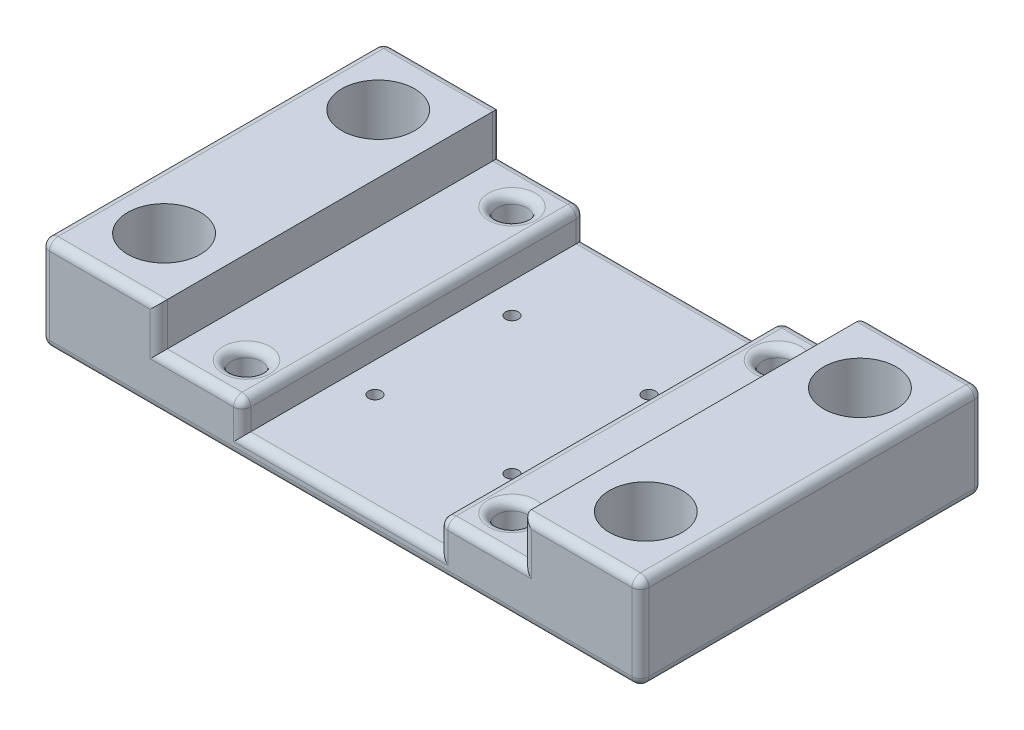
from build123d import *

# Parameters (mm, degrees)
SZKIC1_W                    = 70
SZKIC1_H                    = 40
DODANIE_WYCI_GNI_CIE1_DEPTH = 6
SZKIC2_W                    = 13.75
SZKIC2_H                    = 40
DODANIE_WYCI_GNI_CIE2_DEPTH = 5
SZKIC3_W                    = 23
SZKIC3_H                    = 40
WYTNIJ_WYCI_GNI_CIE1_DEPTH  = 3.5
OTWORY_USTALAJ_CE_6_0MM1_D  = 8.5
SZKIC6_R                    = 1.75
WYTNIJ_WYCI_GNI_CIE2_DEPTH  = 42.785164832
SFAZOWANIE1_SIZE            = 2
OTWORY_USTALAJ_CE_1_5MM1_D  = 1.5
SZYK_LINIOWY1_COUNT         = 2
SZYK_LINIOWY1_PITCH         = 16
SZYK_LINIOWY1_COUNT_DIR2    = 2
SZYK_LINIOWY1_PITCH_DIR2    = 16
ZAOKR_GLENIE1_R             = 1


with BuildPart() as part:
    # Szkic1 → Dodanie-wyciągnięcie1 (new body)
    with BuildSketch(Plane(origin=(0, 0, 0), x_dir=(1, 0, 0), z_dir=(0, 1, 0))):
        Rectangle(SZKIC1_W, SZKIC1_H)
    extrude(amount=DODANIE_WYCI_GNI_CIE1_DEPTH)

    # Szkic2 → Dodanie-wyciągnięcie2 (add)
    with BuildSketch(Plane(origin=(0, 6, 0), x_dir=(1, 0, 0), z_dir=(0, 1, 0))):
        with Locations((-28.125, 0)):
            Rectangle(SZKIC2_W, SZKIC2_H)
        with Locations((28.125, 0)):
            Rectangle(SZKIC2_W, SZKIC2_H)
    extrude(amount=DODANIE_WYCI_GNI_CIE2_DEPTH)

    # Szkic3 → Wytnij-wyciągnięcie1 (cut)
    with BuildSketch(Plane(origin=(0, 6, 0), x_dir=(1, 0, 0), z_dir=(0, 1, 0))):
        Rectangle(SZKIC3_W, SZKIC3_H)
    extrude(amount=-WYTNIJ_WYCI_GNI_CIE1_DEPTH, mode=Mode.SUBTRACT)

    # Otwory ustalające Ø6.0mm1 (through all)
    with Locations(Plane(origin=(0, 11, 0), x_dir=(1, 0, 0), z_dir=(0, 1, 0))):
        with Locations((-28.125, 12.5), (-28.125, -12.5), (28.125, 12.5), (28.125, -12.5)):
            Hole(OTWORY_USTALAJ_CE_6_0MM1_D / 2)

    # Szkic6 → Wytnij-wyciągnięcie2 (cut, through all)
    with BuildSketch(Plane(origin=(0, 0, 0), x_dir=(-1, 0, 0), z_dir=(0, -1, 0))):
        with Locations(Location((15.5, 15.5, 0), (0, 0, 90))):
            Circle(SZKIC6_R)
        with Locations(Location((-15.5, 15.5, 0), (0, 0, 90))):
            Circle(SZKIC6_R)
        with Locations(Location((-15.5, -15.5, 0), (0, 0, 90))):
            Circle(SZKIC6_R)
        with Locations(Location((15.5, -15.5, 0), (0, 0, 90))):
            Circle(SZKIC6_R)
    extrude(amount=-WYTNIJ_WYCI_GNI_CIE2_DEPTH, mode=Mode.SUBTRACT)

    # Sfazowanie1
    sfazowanie1_edges = [part.edges().sort_by_distance(p)[0] for p in [
        (-15.5, 0, 17.25),
        (15.5, 0, 17.25),
        (15.5, 0, -13.75),
        (-15.5, 0, -13.75),
    ]]
    chamfer(sfazowanie1_edges, length=SFAZOWANIE1_SIZE)

    # Otwory ustalające Ø1.5mm1 (through all)
    with Locations(Plane(origin=(0, 2.5, 0), x_dir=(1, 0, 0), z_dir=(0, 1, 0))):
        with Locations((8, -8)):
            otwory_ustalaj_ce_1_5mm1 = Hole(OTWORY_USTALAJ_CE_1_5MM1_D / 2)

    # Szyk liniowy1: Otwory ustalaj_ce _1.5mm1 2 × 2
    with Locations(*[(-i * SZYK_LINIOWY1_PITCH, 0, -j * SZYK_LINIOWY1_PITCH_DIR2) for i in range(SZYK_LINIOWY1_COUNT) for j in range(SZYK_LINIOWY1_COUNT_DIR2) if (i, j) != (0, 0)]):
        add(otwory_ustalaj_ce_1_5mm1, mode=Mode.SUBTRACT)

    # Zaokrąglenie1
    # the kernel refuses this fillet: 1 mm, written as the material it takes off along each edge
    with BuildSketch(Plane(origin=(-12.5, 5, 19), x_dir=(1, 0, 0), z_dir=(0, 0, 1))) as zaokr_glenie1_piece_1_section:
        Polygon((0, 0), (ZAOKR_GLENIE1_R, 0), (ZAOKR_GLENIE1_R, ZAOKR_GLENIE1_R), (0, ZAOKR_GLENIE1_R), align=None)
    zaokr_glenie1_piece_1 = extrude(amount=ZAOKR_GLENIE1_R, mode=Mode.PRIVATE)
    zaokr_glenie1_piece_1 = zaokr_glenie1_piece_1 - Plane(origin=(-12.5, 5, 19), x_dir=(-0.7071067811865475, -0.7071067811865475, 0), z_dir=(0, 0, 1)) * Sphere(ZAOKR_GLENIE1_R, mode=Mode.PRIVATE)
    add(zaokr_glenie1_piece_1, mode=Mode.SUBTRACT)
    with BuildSketch(Plane(origin=(-34, 10, 19), x_dir=(-1, 0, 0), z_dir=(0, 1, 0))) as zaokr_glenie1_piece_2_section:
        Polygon((0, 0), (ZAOKR_GLENIE1_R, 0), (ZAOKR_GLENIE1_R, ZAOKR_GLENIE1_R), (0, ZAOKR_GLENIE1_R), align=None)
    zaokr_glenie1_piece_2 = extrude(amount=ZAOKR_GLENIE1_R, mode=Mode.PRIVATE)
    zaokr_glenie1_piece_2 = zaokr_glenie1_piece_2 - Plane(origin=(-34, 10, 19), x_dir=(0.7071067811865475, 0, -0.7071067811865477), z_dir=(0, 1, 0)) * Sphere(ZAOKR_GLENIE1_R, mode=Mode.PRIVATE)
    add(zaokr_glenie1_piece_2, mode=Mode.SUBTRACT)
    with BuildSketch(Plane(origin=(-34, 10, -19), x_dir=(-1, 0, 0), z_dir=(0, 1, 0))) as zaokr_glenie1_piece_3_section:
        Polygon((0, 0), (ZAOKR_GLENIE1_R, 0), (ZAOKR_GLENIE1_R, -ZAOKR_GLENIE1_R), (0, -ZAOKR_GLENIE1_R), align=None)
    zaokr_glenie1_piece_3 = extrude(amount=ZAOKR_GLENIE1_R, mode=Mode.PRIVATE)
    zaokr_glenie1_piece_3 = zaokr_glenie1_piece_3 - Plane(origin=(-34, 10, -19), x_dir=(0.7071067811865476, 0, 0.7071067811865475), z_dir=(0, 1, 0)) * Sphere(ZAOKR_GLENIE1_R, mode=Mode.PRIVATE)
    add(zaokr_glenie1_piece_3, mode=Mode.SUBTRACT)
    with BuildSketch(Plane(origin=(12.5, 5, -19), x_dir=(0, 1, 0), z_dir=(0, 0, -1))) as zaokr_glenie1_piece_4_section:
        Polygon((0, 0), (ZAOKR_GLENIE1_R, 0), (ZAOKR_GLENIE1_R, -ZAOKR_GLENIE1_R), (0, -ZAOKR_GLENIE1_R), align=None)
    zaokr_glenie1_piece_4 = extrude(amount=ZAOKR_GLENIE1_R, mode=Mode.PRIVATE)
    zaokr_glenie1_piece_4 = zaokr_glenie1_piece_4 - Plane(origin=(12.5, 5, -19), x_dir=(0.7071067811865475, -0.7071067811865475, 0), z_dir=(0, 0, -1)) * Sphere(ZAOKR_GLENIE1_R, mode=Mode.PRIVATE)
    add(zaokr_glenie1_piece_4, mode=Mode.SUBTRACT)
    with BuildSketch(Plane(origin=(34, 10, 19), x_dir=(1, 0, 0), z_dir=(0, 1, 0))) as zaokr_glenie1_piece_5_section:
        Polygon((0, 0), (ZAOKR_GLENIE1_R, 0), (ZAOKR_GLENIE1_R, -ZAOKR_GLENIE1_R), (0, -ZAOKR_GLENIE1_R), align=None)
    zaokr_glenie1_piece_5 = extrude(amount=ZAOKR_GLENIE1_R, mode=Mode.PRIVATE)
    zaokr_glenie1_piece_5 = zaokr_glenie1_piece_5 - Plane(origin=(34, 10, 19), x_dir=(-0.7071067811865475, 0, -0.7071067811865475), z_dir=(0, 1, 0)) * Sphere(ZAOKR_GLENIE1_R, mode=Mode.PRIVATE)
    add(zaokr_glenie1_piece_5, mode=Mode.SUBTRACT)
    with BuildSketch(Plane(origin=(34, 10, -19), x_dir=(1, 0, 0), z_dir=(0, 1, 0))) as zaokr_glenie1_piece_6_section:
        Polygon((0, 0), (ZAOKR_GLENIE1_R, 0), (ZAOKR_GLENIE1_R, ZAOKR_GLENIE1_R), (0, ZAOKR_GLENIE1_R), align=None)
    zaokr_glenie1_piece_6 = extrude(amount=ZAOKR_GLENIE1_R, mode=Mode.PRIVATE)
    zaokr_glenie1_piece_6 = zaokr_glenie1_piece_6 - Plane(origin=(34, 10, -19), x_dir=(-0.7071067811865475, 0, 0.7071067811865475), z_dir=(0, 1, 0)) * Sphere(ZAOKR_GLENIE1_R, mode=Mode.PRIVATE)
    add(zaokr_glenie1_piece_6, mode=Mode.SUBTRACT)
    with BuildSketch(Plane(origin=(12.5, 5, 19), x_dir=(0, 0, 1), z_dir=(0, 1, 0))) as zaokr_glenie1_piece_7_section:
        Polygon((0, 0), (ZAOKR_GLENIE1_R, 0), (ZAOKR_GLENIE1_R, -ZAOKR_GLENIE1_R), (0, -ZAOKR_GLENIE1_R), align=None)
    zaokr_glenie1_piece_7 = extrude(amount=ZAOKR_GLENIE1_R, mode=Mode.PRIVATE)
    zaokr_glenie1_piece_7 = zaokr_glenie1_piece_7 - Plane(origin=(12.5, 5, 19), x_dir=(0.7071067811865476, 0, -0.7071067811865475), z_dir=(0, 1, 0)) * Sphere(ZAOKR_GLENIE1_R, mode=Mode.PRIVATE)
    add(zaokr_glenie1_piece_7, mode=Mode.SUBTRACT)
    with BuildSketch(Plane(origin=(-12.5, 5, -19), x_dir=(1, 0, 0), z_dir=(0, 0, -1))) as zaokr_glenie1_piece_8_section:
        Polygon((0, 0), (ZAOKR_GLENIE1_R, 0), (ZAOKR_GLENIE1_R, -ZAOKR_GLENIE1_R), (0, -ZAOKR_GLENIE1_R), align=None)
    zaokr_glenie1_piece_8 = extrude(amount=ZAOKR_GLENIE1_R, mode=Mode.PRIVATE)
    zaokr_glenie1_piece_8 = zaokr_glenie1_piece_8 - Plane(origin=(-12.5, 5, -19), x_dir=(-0.7071067811865475, -0.7071067811865475, 0), z_dir=(0, 0, -1)) * Sphere(ZAOKR_GLENIE1_R, mode=Mode.PRIVATE)
    add(zaokr_glenie1_piece_8, mode=Mode.SUBTRACT)
    with BuildSketch(Plane(origin=(34, 1, 19), x_dir=(1, 0, 0), z_dir=(0, -1, 0))) as zaokr_glenie1_piece_9_section:
        Polygon((0, 0), (ZAOKR_GLENIE1_R, 0), (ZAOKR_GLENIE1_R, ZAOKR_GLENIE1_R), (0, ZAOKR_GLENIE1_R), align=None)
    zaokr_glenie1_piece_9 = extrude(amount=ZAOKR_GLENIE1_R, mode=Mode.PRIVATE)
    zaokr_glenie1_piece_9 = zaokr_glenie1_piece_9 - Plane(origin=(34, 1, 19), x_dir=(-0.7071067811865475, 0, -0.7071067811865475), z_dir=(0, -1, 0)) * Sphere(ZAOKR_GLENIE1_R, mode=Mode.PRIVATE)
    add(zaokr_glenie1_piece_9, mode=Mode.SUBTRACT)
    with BuildSketch(Plane(origin=(-34, 1, 19), x_dir=(-1, 0, 0), z_dir=(0, -1, 0))) as zaokr_glenie1_piece_10_section:
        Polygon((0, 0), (ZAOKR_GLENIE1_R, 0), (ZAOKR_GLENIE1_R, -ZAOKR_GLENIE1_R), (0, -ZAOKR_GLENIE1_R), align=None)
    zaokr_glenie1_piece_10 = extrude(amount=ZAOKR_GLENIE1_R, mode=Mode.PRIVATE)
    zaokr_glenie1_piece_10 = zaokr_glenie1_piece_10 - Plane(origin=(-34, 1, 19), x_dir=(0.7071067811865475, 0, -0.7071067811865477), z_dir=(0, -1, 0)) * Sphere(ZAOKR_GLENIE1_R, mode=Mode.PRIVATE)
    add(zaokr_glenie1_piece_10, mode=Mode.SUBTRACT)
    with BuildSketch(Plane(origin=(-34, 1, -19), x_dir=(0, 0, -1), z_dir=(0, -1, 0))) as zaokr_glenie1_piece_11_section:
        Polygon((0, 0), (ZAOKR_GLENIE1_R, 0), (ZAOKR_GLENIE1_R, -ZAOKR_GLENIE1_R), (0, -ZAOKR_GLENIE1_R), align=None)
    zaokr_glenie1_piece_11 = extrude(amount=ZAOKR_GLENIE1_R, mode=Mode.PRIVATE)
    zaokr_glenie1_piece_11 = zaokr_glenie1_piece_11 - Plane(origin=(-34, 1, -19), x_dir=(0.7071067811865476, 0, 0.7071067811865475), z_dir=(0, -1, 0)) * Sphere(ZAOKR_GLENIE1_R, mode=Mode.PRIVATE)
    add(zaokr_glenie1_piece_11, mode=Mode.SUBTRACT)
    with BuildSketch(Plane(origin=(34, 1, -19), x_dir=(0, 0, -1), z_dir=(0, -1, 0))) as zaokr_glenie1_piece_12_section:
        Polygon((0, 0), (ZAOKR_GLENIE1_R, 0), (ZAOKR_GLENIE1_R, ZAOKR_GLENIE1_R), (0, ZAOKR_GLENIE1_R), align=None)
    zaokr_glenie1_piece_12 = extrude(amount=ZAOKR_GLENIE1_R, mode=Mode.PRIVATE)
    zaokr_glenie1_piece_12 = zaokr_glenie1_piece_12 - Plane(origin=(34, 1, -19), x_dir=(-0.7071067811865475, 0, 0.7071067811865475), z_dir=(0, -1, 0)) * Sphere(ZAOKR_GLENIE1_R, mode=Mode.PRIVATE)
    add(zaokr_glenie1_piece_12, mode=Mode.SUBTRACT)
    with BuildSketch(Plane(origin=(8, 0, 8), x_dir=(-1, 0, 0), z_dir=(0, 0, 1))) as zaokr_glenie1_piece_13:
        with BuildLine():
            CenterArc((0.75 + ZAOKR_GLENIE1_R, -ZAOKR_GLENIE1_R), ZAOKR_GLENIE1_R, 90, 90)
            Line((0.75, -ZAOKR_GLENIE1_R), (0.75, 0))
            Line((0.75, 0), (0.75 + ZAOKR_GLENIE1_R, 0))
        make_face()
    revolve(axis=Axis((8, 0, 8), (0, -1, 0)), mode=Mode.SUBTRACT)
    with BuildSketch(Plane(origin=(-8, 0, 8), x_dir=(-1, 0, 0), z_dir=(0, 0, 1))) as zaokr_glenie1_piece_14:
        with BuildLine():
            CenterArc((0.75 + ZAOKR_GLENIE1_R, -ZAOKR_GLENIE1_R), ZAOKR_GLENIE1_R, 90, 90)
            Line((0.75, -ZAOKR_GLENIE1_R), (0.75, 0))
            Line((0.75, 0), (0.75 + ZAOKR_GLENIE1_R, 0))
        make_face()
    revolve(axis=Axis((-8, 0, 8), (0, -1, 0)), mode=Mode.SUBTRACT)
    with BuildSketch(Plane(origin=(8, 0, -8), x_dir=(-1, 0, 0), z_dir=(0, 0, 1))) as zaokr_glenie1_piece_15:
        with BuildLine():
            CenterArc((0.75 + ZAOKR_GLENIE1_R, -ZAOKR_GLENIE1_R), ZAOKR_GLENIE1_R, 90, 90)
            Line((0.75, -ZAOKR_GLENIE1_R), (0.75, 0))
            Line((0.75, 0), (0.75 + ZAOKR_GLENIE1_R, 0))
        make_face()
    revolve(axis=Axis((8, 0, -8), (0, -1, 0)), mode=Mode.SUBTRACT)
    with BuildSketch(Plane(origin=(-8, 0, -8), x_dir=(-1, 0, 0), z_dir=(0, 0, 1))) as zaokr_glenie1_piece_16:
        with BuildLine():
            CenterArc((0.75 + ZAOKR_GLENIE1_R, -ZAOKR_GLENIE1_R), ZAOKR_GLENIE1_R, 90, 90)
            Line((0.75, -ZAOKR_GLENIE1_R), (0.75, 0))
            Line((0.75, 0), (0.75 + ZAOKR_GLENIE1_R, 0))
        make_face()
    revolve(axis=Axis((-8, 0, -8), (0, -1, 0)), mode=Mode.SUBTRACT)
    with BuildSketch(Plane(origin=(-12.5, 6, 20), x_dir=(0, -1, 0), z_dir=(-1, 0, 0)), Plane(origin=(12.5, 6, -20), x_dir=(0, -1, 0), z_dir=(1, 0, 0)), Plane(origin=(21.25, 6, 20), x_dir=(0, -1, 0), z_dir=(-1, 0, 0)), Plane(origin=(-21.25, 6, -20), x_dir=(0, -1, 0), z_dir=(1, 0, 0))) as zaokr_glenie1_piece_17:
        with BuildLine():
            CenterArc((ZAOKR_GLENIE1_R, -ZAOKR_GLENIE1_R), ZAOKR_GLENIE1_R, 90, 90)
            Line((0, -ZAOKR_GLENIE1_R), (0, 0))
            Line((0, 0), (ZAOKR_GLENIE1_R, 0))
        make_face()
    extrude(amount=8.75, mode=Mode.SUBTRACT)
    with BuildSketch(Plane(origin=(-21.25, 6, 20), x_dir=(-1, 0, 0), z_dir=(0, 1, 0)), Plane(origin=(21.25, 6, -20), x_dir=(1, 0, 0), z_dir=(0, 1, 0))) as zaokr_glenie1_piece_18:
        with BuildLine():
            CenterArc((ZAOKR_GLENIE1_R, -ZAOKR_GLENIE1_R), ZAOKR_GLENIE1_R, 90, 90)
            Line((0, -ZAOKR_GLENIE1_R), (0, 0))
            Line((0, 0), (ZAOKR_GLENIE1_R, 0))
        make_face()
    extrude(amount=7.5, mode=Mode.SUBTRACT)
    with BuildSketch(Plane(origin=(-21.25, 6, -20), x_dir=(-1, 0, 0), z_dir=(0, 1, 0)), Plane(origin=(21.25, 6, 20), x_dir=(1, 0, 0), z_dir=(0, 1, 0))) as zaokr_glenie1_piece_19:
        with BuildLine():
            CenterArc((ZAOKR_GLENIE1_R, ZAOKR_GLENIE1_R), ZAOKR_GLENIE1_R, 180, 90)
            Line((0, ZAOKR_GLENIE1_R), (0, 0))
            Line((0, 0), (ZAOKR_GLENIE1_R, 0))
        make_face()
    extrude(amount=7.5, mode=Mode.SUBTRACT)
    with BuildSketch(Plane(origin=(-35, 11, 19), x_dir=(0, -1, 0), z_dir=(0, 0, -1)), Plane(origin=(11.5, 6, -19), x_dir=(1, 0, 0), z_dir=(0, 0, 1)), Plane(origin=(-35, 0, 19), x_dir=(1, 0, 0), z_dir=(0, 0, -1)), Plane(origin=(35, 0, -19), x_dir=(-1, 0, 0), z_dir=(0, 0, 1))) as zaokr_glenie1_piece_20:
        with BuildLine():
            CenterArc((ZAOKR_GLENIE1_R, -ZAOKR_GLENIE1_R), ZAOKR_GLENIE1_R, 90, 90)
            Line((0, -ZAOKR_GLENIE1_R), (0, 0))
            Line((0, 0), (ZAOKR_GLENIE1_R, 0))
        make_face()
    extrude(amount=38, mode=Mode.SUBTRACT)
    with BuildSketch(Plane(origin=(-18.75, 11, 20), x_dir=(0, -1, 0), z_dir=(-1, 0, 0)), Plane(origin=(-34, 11, -20), x_dir=(0, -1, 0), z_dir=(1, 0, 0))) as zaokr_glenie1_piece_21:
        with BuildLine():
            CenterArc((ZAOKR_GLENIE1_R, -ZAOKR_GLENIE1_R), ZAOKR_GLENIE1_R, 90, 90)
            Line((0, -ZAOKR_GLENIE1_R), (0, 0))
            Line((0, 0), (ZAOKR_GLENIE1_R, 0))
        make_face()
    extrude(amount=15.25, mode=Mode.SUBTRACT)
    with BuildSketch(Plane(origin=(35, 11, 19), x_dir=(0, -1, 0), z_dir=(0, 0, -1)), Plane(origin=(-11.5, 6, 19), x_dir=(0, -1, 0), z_dir=(0, 0, -1))) as zaokr_glenie1_piece_22:
        with BuildLine():
            CenterArc((ZAOKR_GLENIE1_R, ZAOKR_GLENIE1_R), ZAOKR_GLENIE1_R, 180, 90)
            Line((0, ZAOKR_GLENIE1_R), (0, 0))
            Line((0, 0), (ZAOKR_GLENIE1_R, 0))
        make_face()
    extrude(amount=38, mode=Mode.SUBTRACT)
    with BuildSketch(Plane(origin=(34, 11, -20), x_dir=(0, -1, 0), z_dir=(-1, 0, 0)), Plane(origin=(18.75, 11, 20), x_dir=(0, -1, 0), z_dir=(1, 0, 0))) as zaokr_glenie1_piece_23:
        with BuildLine():
            CenterArc((ZAOKR_GLENIE1_R, ZAOKR_GLENIE1_R), ZAOKR_GLENIE1_R, 180, 90)
            Line((0, ZAOKR_GLENIE1_R), (0, 0))
            Line((0, 0), (ZAOKR_GLENIE1_R, 0))
        make_face()
    extrude(amount=15.25, mode=Mode.SUBTRACT)
    with BuildSketch(Plane(origin=(-11.5, 5, 20), x_dir=(-1, 0, 0), z_dir=(0, -1, 0)), Plane(origin=(11.5, 5, -20), x_dir=(1, 0, 0), z_dir=(0, -1, 0))) as zaokr_glenie1_piece_24:
        with BuildLine():
            CenterArc((ZAOKR_GLENIE1_R, ZAOKR_GLENIE1_R), ZAOKR_GLENIE1_R, 180, 90)
            Line((0, ZAOKR_GLENIE1_R), (0, 0))
            Line((0, 0), (ZAOKR_GLENIE1_R, 0))
        make_face()
    extrude(amount=2.5, mode=Mode.SUBTRACT)
    with BuildSketch(Plane(origin=(-11.5, 2.5, -20), x_dir=(0, -1, 0), z_dir=(1, 0, 0)), Plane(origin=(11.5, 2.5, 20), x_dir=(0, -1, 0), z_dir=(-1, 0, 0))) as zaokr_glenie1_piece_25:
        with BuildLine():
            CenterArc((ZAOKR_GLENIE1_R, -ZAOKR_GLENIE1_R), ZAOKR_GLENIE1_R, 90, 90)
            Line((0, -ZAOKR_GLENIE1_R), (0, 0))
            Line((0, 0), (ZAOKR_GLENIE1_R, 0))
        make_face()
    extrude(amount=23, mode=Mode.SUBTRACT)
    with BuildSketch(Plane(origin=(-11.5, 5, -20), x_dir=(-1, 0, 0), z_dir=(0, -1, 0)), Plane(origin=(11.5, 5, 20), x_dir=(1, 0, 0), z_dir=(0, -1, 0))) as zaokr_glenie1_piece_26:
        with BuildLine():
            CenterArc((ZAOKR_GLENIE1_R, -ZAOKR_GLENIE1_R), ZAOKR_GLENIE1_R, 90, 90)
            Line((0, -ZAOKR_GLENIE1_R), (0, 0))
            Line((0, 0), (ZAOKR_GLENIE1_R, 0))
        make_face()
    extrude(amount=2.5, mode=Mode.SUBTRACT)
    with BuildSketch(Plane(origin=(34, 0, 20), x_dir=(0, 0, -1), z_dir=(-1, 0, 0)), Plane(origin=(-34, 0, -20), x_dir=(0, 0, 1), z_dir=(1, 0, 0))) as zaokr_glenie1_piece_27:
        with BuildLine():
            CenterArc((ZAOKR_GLENIE1_R, -ZAOKR_GLENIE1_R), ZAOKR_GLENIE1_R, 90, 90)
            Line((0, -ZAOKR_GLENIE1_R), (0, 0))
            Line((0, 0), (ZAOKR_GLENIE1_R, 0))
        make_face()
    extrude(amount=68, mode=Mode.SUBTRACT)
    with BuildSketch(Plane(origin=(28.125, 0, 12.5), x_dir=(-1, 0, 0), z_dir=(0, 0, 1))) as zaokr_glenie1_piece_28:
        with BuildLine():
            CenterArc((4.25 + ZAOKR_GLENIE1_R, -ZAOKR_GLENIE1_R), ZAOKR_GLENIE1_R, 90, 90)
            Line((4.25, -ZAOKR_GLENIE1_R), (4.25, 0))
            Line((4.25, 0), (4.25 + ZAOKR_GLENIE1_R, 0))
        make_face()
    revolve(axis=Axis((28.125, 0, 12.5), (0, -1, 0)), mode=Mode.SUBTRACT)
    with BuildSketch(Plane(origin=(28.125, 0, -12.5), x_dir=(-1, 0, 0), z_dir=(0, 0, 1))) as zaokr_glenie1_piece_29:
        with BuildLine():
            CenterArc((4.25 + ZAOKR_GLENIE1_R, -ZAOKR_GLENIE1_R), ZAOKR_GLENIE1_R, 90, 90)
            Line((4.25, -ZAOKR_GLENIE1_R), (4.25, 0))
            Line((4.25, 0), (4.25 + ZAOKR_GLENIE1_R, 0))
        make_face()
    revolve(axis=Axis((28.125, 0, -12.5), (0, -1, 0)), mode=Mode.SUBTRACT)
    with BuildSketch(Plane(origin=(-28.125, 0, 12.5), x_dir=(-1, 0, 0), z_dir=(0, 0, 1))) as zaokr_glenie1_piece_30:
        with BuildLine():
            CenterArc((4.25 + ZAOKR_GLENIE1_R, -ZAOKR_GLENIE1_R), ZAOKR_GLENIE1_R, 90, 90)
            Line((4.25, -ZAOKR_GLENIE1_R), (4.25, 0))
            Line((4.25, 0), (4.25 + ZAOKR_GLENIE1_R, 0))
        make_face()
    revolve(axis=Axis((-28.125, 0, 12.5), (0, -1, 0)), mode=Mode.SUBTRACT)
    with BuildSketch(Plane(origin=(-28.125, 0, -12.5), x_dir=(-1, 0, 0), z_dir=(0, 0, 1))) as zaokr_glenie1_piece_31:
        with BuildLine():
            CenterArc((4.25 + ZAOKR_GLENIE1_R, -ZAOKR_GLENIE1_R), ZAOKR_GLENIE1_R, 90, 90)
            Line((4.25, -ZAOKR_GLENIE1_R), (4.25, 0))
            Line((4.25, 0), (4.25 + ZAOKR_GLENIE1_R, 0))
        make_face()
    revolve(axis=Axis((-28.125, 0, -12.5), (0, -1, 0)), mode=Mode.SUBTRACT)
    with BuildSketch(Plane(origin=(35, 10, 20), x_dir=(0, 0, -1), z_dir=(0, -1, 0)), Plane(origin=(-35, 1, 20), x_dir=(0, 0, -1), z_dir=(0, 1, 0)), Plane(origin=(-35, 1, -20), x_dir=(1, 0, 0), z_dir=(0, 1, 0)), Plane(origin=(35, 10, -20), x_dir=(-1, 0, 0), z_dir=(0, -1, 0))) as zaokr_glenie1_piece_32:
        with BuildLine():
            CenterArc((ZAOKR_GLENIE1_R, -ZAOKR_GLENIE1_R), ZAOKR_GLENIE1_R, 90, 90)
            Line((0, -ZAOKR_GLENIE1_R), (0, 0))
            Line((0, 0), (ZAOKR_GLENIE1_R, 0))
        make_face()
    extrude(amount=9, mode=Mode.SUBTRACT)
    with BuildSketch(Plane(origin=(-15.5, 6, 15.5), x_dir=(0, 0, -1), z_dir=(-1, 0, 0))) as zaokr_glenie1_piece_33:
        with BuildLine():
            CenterArc((1.75 + ZAOKR_GLENIE1_R, ZAOKR_GLENIE1_R), ZAOKR_GLENIE1_R, 180, 90)
            Line((1.75, ZAOKR_GLENIE1_R), (1.75, 0))
            Line((1.75, 0), (1.75 + ZAOKR_GLENIE1_R, 0))
        make_face()
    revolve(axis=Axis((-15.5, 6, 15.5), (0, -1, 0)), mode=Mode.SUBTRACT)
    with BuildSketch(Plane(origin=(15.5, 6, 15.5), x_dir=(0, 0, -1), z_dir=(-1, 0, 0))) as zaokr_glenie1_piece_34:
        with BuildLine():
            CenterArc((1.75 + ZAOKR_GLENIE1_R, ZAOKR_GLENIE1_R), ZAOKR_GLENIE1_R, 180, 90)
            Line((1.75, ZAOKR_GLENIE1_R), (1.75, 0))
            Line((1.75, 0), (1.75 + ZAOKR_GLENIE1_R, 0))
        make_face()
    revolve(axis=Axis((15.5, 6, 15.5), (0, -1, 0)), mode=Mode.SUBTRACT)
    with BuildSketch(Plane(origin=(15.5, 6, -15.5), x_dir=(0, 0, -1), z_dir=(-1, 0, 0))) as zaokr_glenie1_piece_35:
        with BuildLine():
            CenterArc((1.75 + ZAOKR_GLENIE1_R, ZAOKR_GLENIE1_R), ZAOKR_GLENIE1_R, 180, 90)
            Line((1.75, ZAOKR_GLENIE1_R), (1.75, 0))
            Line((1.75, 0), (1.75 + ZAOKR_GLENIE1_R, 0))
        make_face()
    revolve(axis=Axis((15.5, 6, -15.5), (0, -1, 0)), mode=Mode.SUBTRACT)
    with BuildSketch(Plane(origin=(-15.5, 6, -15.5), x_dir=(0, 0, -1), z_dir=(-1, 0, 0))) as zaokr_glenie1_piece_36:
        with BuildLine():
            CenterArc((1.75 + ZAOKR_GLENIE1_R, ZAOKR_GLENIE1_R), ZAOKR_GLENIE1_R, 180, 90)
            Line((1.75, ZAOKR_GLENIE1_R), (1.75, 0))
            Line((1.75, 0), (1.75 + ZAOKR_GLENIE1_R, 0))
        make_face()
    revolve(axis=Axis((-15.5, 6, -15.5), (0, -1, 0)), mode=Mode.SUBTRACT)
    with BuildSketch(Plane(origin=(-15.5, 0, 15.5), x_dir=(0, 0, -1), z_dir=(-1, 0, 0))) as zaokr_glenie1_piece_37:
        with BuildLine():
            CenterArc((3.75 + ZAOKR_GLENIE1_R * 0.414213562373, -ZAOKR_GLENIE1_R), ZAOKR_GLENIE1_R, 90, 45)
            Line((3.75 - ZAOKR_GLENIE1_R * 0.292893218813, -ZAOKR_GLENIE1_R * 0.292893218813), (3.75, 0))
            Line((3.75, 0), (3.75 + ZAOKR_GLENIE1_R * 0.414213562373, 0))
        make_face()
    revolve(axis=Axis((-15.5, 0, 15.5), (0, -1, 0)), mode=Mode.SUBTRACT)
    with BuildSketch(Plane(origin=(-15.5, 0, -15.5), x_dir=(0, 0, -1), z_dir=(-1, 0, 0))) as zaokr_glenie1_piece_38:
        with BuildLine():
            CenterArc((3.75 + ZAOKR_GLENIE1_R * 0.414213562373, -ZAOKR_GLENIE1_R), ZAOKR_GLENIE1_R, 90, 45)
            Line((3.75 - ZAOKR_GLENIE1_R * 0.292893218813, -ZAOKR_GLENIE1_R * 0.292893218813), (3.75, 0))
            Line((3.75, 0), (3.75 + ZAOKR_GLENIE1_R * 0.414213562373, 0))
        make_face()
    revolve(axis=Axis((-15.5, 0, -15.5), (0, -1, 0)), mode=Mode.SUBTRACT)
    with BuildSketch(Plane(origin=(15.5, 0, -15.5), x_dir=(0, 0, -1), z_dir=(-1, 0, 0))) as zaokr_glenie1_piece_39:
        with BuildLine():
            CenterArc((3.75 + ZAOKR_GLENIE1_R * 0.414213562373, -ZAOKR_GLENIE1_R), ZAOKR_GLENIE1_R, 90, 45)
            Line((3.75 - ZAOKR_GLENIE1_R * 0.292893218813, -ZAOKR_GLENIE1_R * 0.292893218813), (3.75, 0))
            Line((3.75, 0), (3.75 + ZAOKR_GLENIE1_R * 0.414213562373, 0))
        make_face()
    revolve(axis=Axis((15.5, 0, -15.5), (0, -1, 0)), mode=Mode.SUBTRACT)
    with BuildSketch(Plane(origin=(15.5, 0, 15.5), x_dir=(0, 0, -1), z_dir=(-1, 0, 0))) as zaokr_glenie1_piece_40:
        with BuildLine():
            CenterArc((3.75 + ZAOKR_GLENIE1_R * 0.414213562373, -ZAOKR_GLENIE1_R), ZAOKR_GLENIE1_R, 90, 45)
            Line((3.75 - ZAOKR_GLENIE1_R * 0.292893218813, -ZAOKR_GLENIE1_R * 0.292893218813), (3.75, 0))
            Line((3.75, 0), (3.75 + ZAOKR_GLENIE1_R * 0.414213562373, 0))
        make_face()
    revolve(axis=Axis((15.5, 0, 15.5), (0, -1, 0)), mode=Mode.SUBTRACT)
    with BuildSketch(Plane(origin=(-21.25, 3.5, 20), x_dir=(-1, 0, 0), z_dir=(0, 1, 0))) as zaokr_glenie1_piece_41a_section:
        with BuildLine():
            CenterArc((ZAOKR_GLENIE1_R, -ZAOKR_GLENIE1_R), ZAOKR_GLENIE1_R, 90, 90)
            Line((0, -ZAOKR_GLENIE1_R), (0, 0))
            Line((0, 0), (ZAOKR_GLENIE1_R, 0))
        make_face()
    zaokr_glenie1_piece_41a = extrude(amount=10, mode=Mode.PRIVATE)
    zaokr_glenie1_piece_41a = split(zaokr_glenie1_piece_41a, bisect_by=Plane(origin=(-21.476395114, 6, 19.773604886), z_dir=(0, -1, 0)), keep=Keep.TOP, mode=Mode.PRIVATE)
    with BuildSketch(Plane(origin=(-12.5, 6, 20), x_dir=(0, -1, 0), z_dir=(-1, 0, 0))) as zaokr_glenie1_piece_41b_section:
        with BuildLine():
            CenterArc((ZAOKR_GLENIE1_R, -ZAOKR_GLENIE1_R), ZAOKR_GLENIE1_R, 90, 90)
            Line((0, -ZAOKR_GLENIE1_R), (0, 0))
            Line((0, 0), (ZAOKR_GLENIE1_R, 0))
        make_face()
    zaokr_glenie1_piece_41b = extrude(amount=11.25, mode=Mode.PRIVATE)
    zaokr_glenie1_piece_41b = split(zaokr_glenie1_piece_41b, bisect_by=Plane(origin=(-21.25, 5.773604886, 19.773604886), z_dir=(-1, 0, 0)), keep=Keep.TOP, mode=Mode.PRIVATE)
    zaokr_glenie1_piece_41 = zaokr_glenie1_piece_41a & zaokr_glenie1_piece_41b
    add(zaokr_glenie1_piece_41, mode=Mode.SUBTRACT)
    with BuildSketch(Plane(origin=(-23.75, 6, -20), x_dir=(0, -1, 0), z_dir=(1, 0, 0))) as zaokr_glenie1_piece_42a_section:
        with BuildLine():
            CenterArc((ZAOKR_GLENIE1_R, -ZAOKR_GLENIE1_R), ZAOKR_GLENIE1_R, 90, 90)
            Line((0, -ZAOKR_GLENIE1_R), (0, 0))
            Line((0, 0), (ZAOKR_GLENIE1_R, 0))
        make_face()
    zaokr_glenie1_piece_42a = extrude(amount=11.25, mode=Mode.PRIVATE)
    zaokr_glenie1_piece_42a = split(zaokr_glenie1_piece_42a, bisect_by=Plane(origin=(-21.25, 5.773604886, -19.773604886), z_dir=(-1, 0, 0)), keep=Keep.TOP, mode=Mode.PRIVATE)
    with BuildSketch(Plane(origin=(-21.25, 3.5, -20), x_dir=(-1, 0, 0), z_dir=(0, 1, 0))) as zaokr_glenie1_piece_42b_section:
        with BuildLine():
            CenterArc((ZAOKR_GLENIE1_R, ZAOKR_GLENIE1_R), ZAOKR_GLENIE1_R, 180, 90)
            Line((0, ZAOKR_GLENIE1_R), (0, 0))
            Line((0, 0), (ZAOKR_GLENIE1_R, 0))
        make_face()
    zaokr_glenie1_piece_42b = extrude(amount=10, mode=Mode.PRIVATE)
    zaokr_glenie1_piece_42b = split(zaokr_glenie1_piece_42b, bisect_by=Plane(origin=(-21.476395114, 6, -19.773604886), z_dir=(0, -1, 0)), keep=Keep.TOP, mode=Mode.PRIVATE)
    zaokr_glenie1_piece_42 = zaokr_glenie1_piece_42a & zaokr_glenie1_piece_42b
    add(zaokr_glenie1_piece_42, mode=Mode.SUBTRACT)
    with BuildSketch(Plane(origin=(21.25, 3.5, -20), x_dir=(1, 0, 0), z_dir=(0, 1, 0))) as zaokr_glenie1_piece_43a_section:
        with BuildLine():
            CenterArc((ZAOKR_GLENIE1_R, -ZAOKR_GLENIE1_R), ZAOKR_GLENIE1_R, 90, 90)
            Line((0, -ZAOKR_GLENIE1_R), (0, 0))
            Line((0, 0), (ZAOKR_GLENIE1_R, 0))
        make_face()
    zaokr_glenie1_piece_43a = extrude(amount=10, mode=Mode.PRIVATE)
    zaokr_glenie1_piece_43a = split(zaokr_glenie1_piece_43a, bisect_by=Plane(origin=(21.476395114, 6, -19.773604886), z_dir=(0, -1, 0)), keep=Keep.TOP, mode=Mode.PRIVATE)
    with BuildSketch(Plane(origin=(12.5, 6, -20), x_dir=(0, -1, 0), z_dir=(1, 0, 0))) as zaokr_glenie1_piece_43b_section:
        with BuildLine():
            CenterArc((ZAOKR_GLENIE1_R, -ZAOKR_GLENIE1_R), ZAOKR_GLENIE1_R, 90, 90)
            Line((0, -ZAOKR_GLENIE1_R), (0, 0))
            Line((0, 0), (ZAOKR_GLENIE1_R, 0))
        make_face()
    zaokr_glenie1_piece_43b = extrude(amount=11.25, mode=Mode.PRIVATE)
    zaokr_glenie1_piece_43b = split(zaokr_glenie1_piece_43b, bisect_by=Plane(origin=(21.25, 5.773604886, -19.773604886), z_dir=(1, 0, 0)), keep=Keep.TOP, mode=Mode.PRIVATE)
    zaokr_glenie1_piece_43 = zaokr_glenie1_piece_43a & zaokr_glenie1_piece_43b
    add(zaokr_glenie1_piece_43, mode=Mode.SUBTRACT)
    with BuildSketch(Plane(origin=(23.75, 6, 20), x_dir=(0, -1, 0), z_dir=(-1, 0, 0))) as zaokr_glenie1_piece_44a_section:
        with BuildLine():
            CenterArc((ZAOKR_GLENIE1_R, -ZAOKR_GLENIE1_R), ZAOKR_GLENIE1_R, 90, 90)
            Line((0, -ZAOKR_GLENIE1_R), (0, 0))
            Line((0, 0), (ZAOKR_GLENIE1_R, 0))
        make_face()
    zaokr_glenie1_piece_44a = extrude(amount=11.25, mode=Mode.PRIVATE)
    zaokr_glenie1_piece_44a = split(zaokr_glenie1_piece_44a, bisect_by=Plane(origin=(21.25, 5.773604886, 19.773604886), z_dir=(1, 0, 0)), keep=Keep.TOP, mode=Mode.PRIVATE)
    with BuildSketch(Plane(origin=(21.25, 3.5, 20), x_dir=(1, 0, 0), z_dir=(0, 1, 0))) as zaokr_glenie1_piece_44b_section:
        with BuildLine():
            CenterArc((ZAOKR_GLENIE1_R, ZAOKR_GLENIE1_R), ZAOKR_GLENIE1_R, 180, 90)
            Line((0, ZAOKR_GLENIE1_R), (0, 0))
            Line((0, 0), (ZAOKR_GLENIE1_R, 0))
        make_face()
    zaokr_glenie1_piece_44b = extrude(amount=10, mode=Mode.PRIVATE)
    zaokr_glenie1_piece_44b = split(zaokr_glenie1_piece_44b, bisect_by=Plane(origin=(21.476395114, 6, 19.773604886), z_dir=(0, -1, 0)), keep=Keep.TOP, mode=Mode.PRIVATE)
    zaokr_glenie1_piece_44 = zaokr_glenie1_piece_44a & zaokr_glenie1_piece_44b
    add(zaokr_glenie1_piece_44, mode=Mode.SUBTRACT)
    with BuildSketch(Plane(origin=(-11.5, 5, 20), x_dir=(-1, 0, 0), z_dir=(0, -1, 0))) as zaokr_glenie1_piece_45a_section:
        with BuildLine():
            CenterArc((ZAOKR_GLENIE1_R, ZAOKR_GLENIE1_R), ZAOKR_GLENIE1_R, 180, 90)
            Line((0, ZAOKR_GLENIE1_R), (0, 0))
            Line((0, 0), (ZAOKR_GLENIE1_R, 0))
        make_face()
    zaokr_glenie1_piece_45a = extrude(amount=5, mode=Mode.PRIVATE)
    zaokr_glenie1_piece_45a = split(zaokr_glenie1_piece_45a, bisect_by=Plane(origin=(-11.726395114, 2.5, 19.773604886), z_dir=(0, -1, 0)), keep=Keep.TOP, mode=Mode.PRIVATE)
    with BuildSketch(Plane(origin=(11.5, 2.5, 20), x_dir=(0, -1, 0), z_dir=(-1, 0, 0))) as zaokr_glenie1_piece_45b_section:
        with BuildLine():
            CenterArc((ZAOKR_GLENIE1_R, -ZAOKR_GLENIE1_R), ZAOKR_GLENIE1_R, 90, 90)
            Line((0, -ZAOKR_GLENIE1_R), (0, 0))
            Line((0, 0), (ZAOKR_GLENIE1_R, 0))
        make_face()
    zaokr_glenie1_piece_45b = extrude(amount=25.5, mode=Mode.PRIVATE)
    zaokr_glenie1_piece_45b = split(zaokr_glenie1_piece_45b, bisect_by=Plane(origin=(-11.5, 2.273604886, 19.773604886), z_dir=(-1, 0, 0)), keep=Keep.TOP, mode=Mode.PRIVATE)
    zaokr_glenie1_piece_45 = zaokr_glenie1_piece_45a & zaokr_glenie1_piece_45b
    add(zaokr_glenie1_piece_45, mode=Mode.SUBTRACT)
    with BuildSketch(Plane(origin=(-14, 2.5, -20), x_dir=(0, -1, 0), z_dir=(1, 0, 0))) as zaokr_glenie1_piece_46a_section:
        with BuildLine():
            CenterArc((ZAOKR_GLENIE1_R, -ZAOKR_GLENIE1_R), ZAOKR_GLENIE1_R, 90, 90)
            Line((0, -ZAOKR_GLENIE1_R), (0, 0))
            Line((0, 0), (ZAOKR_GLENIE1_R, 0))
        make_face()
    zaokr_glenie1_piece_46a = extrude(amount=25.5, mode=Mode.PRIVATE)
    zaokr_glenie1_piece_46a = split(zaokr_glenie1_piece_46a, bisect_by=Plane(origin=(-11.5, 2.273604886, -19.773604886), z_dir=(-1, 0, 0)), keep=Keep.TOP, mode=Mode.PRIVATE)
    with BuildSketch(Plane(origin=(-11.5, 5, -20), x_dir=(-1, 0, 0), z_dir=(0, -1, 0))) as zaokr_glenie1_piece_46b_section:
        with BuildLine():
            CenterArc((ZAOKR_GLENIE1_R, -ZAOKR_GLENIE1_R), ZAOKR_GLENIE1_R, 90, 90)
            Line((0, -ZAOKR_GLENIE1_R), (0, 0))
            Line((0, 0), (ZAOKR_GLENIE1_R, 0))
        make_face()
    zaokr_glenie1_piece_46b = extrude(amount=5, mode=Mode.PRIVATE)
    zaokr_glenie1_piece_46b = split(zaokr_glenie1_piece_46b, bisect_by=Plane(origin=(-11.726395114, 2.5, -19.773604886), z_dir=(0, -1, 0)), keep=Keep.TOP, mode=Mode.PRIVATE)
    zaokr_glenie1_piece_46 = zaokr_glenie1_piece_46a & zaokr_glenie1_piece_46b
    add(zaokr_glenie1_piece_46, mode=Mode.SUBTRACT)
    with BuildSketch(Plane(origin=(11.5, 5, -20), x_dir=(1, 0, 0), z_dir=(0, -1, 0))) as zaokr_glenie1_piece_47a_section:
        with BuildLine():
            CenterArc((ZAOKR_GLENIE1_R, ZAOKR_GLENIE1_R), ZAOKR_GLENIE1_R, 180, 90)
            Line((0, ZAOKR_GLENIE1_R), (0, 0))
            Line((0, 0), (ZAOKR_GLENIE1_R, 0))
        make_face()
    zaokr_glenie1_piece_47a = extrude(amount=5, mode=Mode.PRIVATE)
    zaokr_glenie1_piece_47a = split(zaokr_glenie1_piece_47a, bisect_by=Plane(origin=(11.726395114, 2.5, -19.773604886), z_dir=(0, -1, 0)), keep=Keep.TOP, mode=Mode.PRIVATE)
    with BuildSketch(Plane(origin=(-11.5, 2.5, -20), x_dir=(0, -1, 0), z_dir=(1, 0, 0))) as zaokr_glenie1_piece_47b_section:
        with BuildLine():
            CenterArc((ZAOKR_GLENIE1_R, -ZAOKR_GLENIE1_R), ZAOKR_GLENIE1_R, 90, 90)
            Line((0, -ZAOKR_GLENIE1_R), (0, 0))
            Line((0, 0), (ZAOKR_GLENIE1_R, 0))
        make_face()
    zaokr_glenie1_piece_47b = extrude(amount=25.5, mode=Mode.PRIVATE)
    zaokr_glenie1_piece_47b = split(zaokr_glenie1_piece_47b, bisect_by=Plane(origin=(11.5, 2.273604886, -19.773604886), z_dir=(1, 0, 0)), keep=Keep.TOP, mode=Mode.PRIVATE)
    zaokr_glenie1_piece_47 = zaokr_glenie1_piece_47a & zaokr_glenie1_piece_47b
    add(zaokr_glenie1_piece_47, mode=Mode.SUBTRACT)
    with BuildSketch(Plane(origin=(14, 2.5, 20), x_dir=(0, -1, 0), z_dir=(-1, 0, 0))) as zaokr_glenie1_piece_48a_section:
        with BuildLine():
            CenterArc((ZAOKR_GLENIE1_R, -ZAOKR_GLENIE1_R), ZAOKR_GLENIE1_R, 90, 90)
            Line((0, -ZAOKR_GLENIE1_R), (0, 0))
            Line((0, 0), (ZAOKR_GLENIE1_R, 0))
        make_face()
    zaokr_glenie1_piece_48a = extrude(amount=25.5, mode=Mode.PRIVATE)
    zaokr_glenie1_piece_48a = split(zaokr_glenie1_piece_48a, bisect_by=Plane(origin=(11.5, 2.273604886, 19.773604886), z_dir=(1, 0, 0)), keep=Keep.TOP, mode=Mode.PRIVATE)
    with BuildSketch(Plane(origin=(11.5, 5, 20), x_dir=(1, 0, 0), z_dir=(0, -1, 0))) as zaokr_glenie1_piece_48b_section:
        with BuildLine():
            CenterArc((ZAOKR_GLENIE1_R, -ZAOKR_GLENIE1_R), ZAOKR_GLENIE1_R, 90, 90)
            Line((0, -ZAOKR_GLENIE1_R), (0, 0))
            Line((0, 0), (ZAOKR_GLENIE1_R, 0))
        make_face()
    zaokr_glenie1_piece_48b = extrude(amount=5, mode=Mode.PRIVATE)
    zaokr_glenie1_piece_48b = split(zaokr_glenie1_piece_48b, bisect_by=Plane(origin=(11.726395114, 2.5, 19.773604886), z_dir=(0, -1, 0)), keep=Keep.TOP, mode=Mode.PRIVATE)
    zaokr_glenie1_piece_48 = zaokr_glenie1_piece_48a & zaokr_glenie1_piece_48b
    add(zaokr_glenie1_piece_48, mode=Mode.SUBTRACT)


solid = part.part
